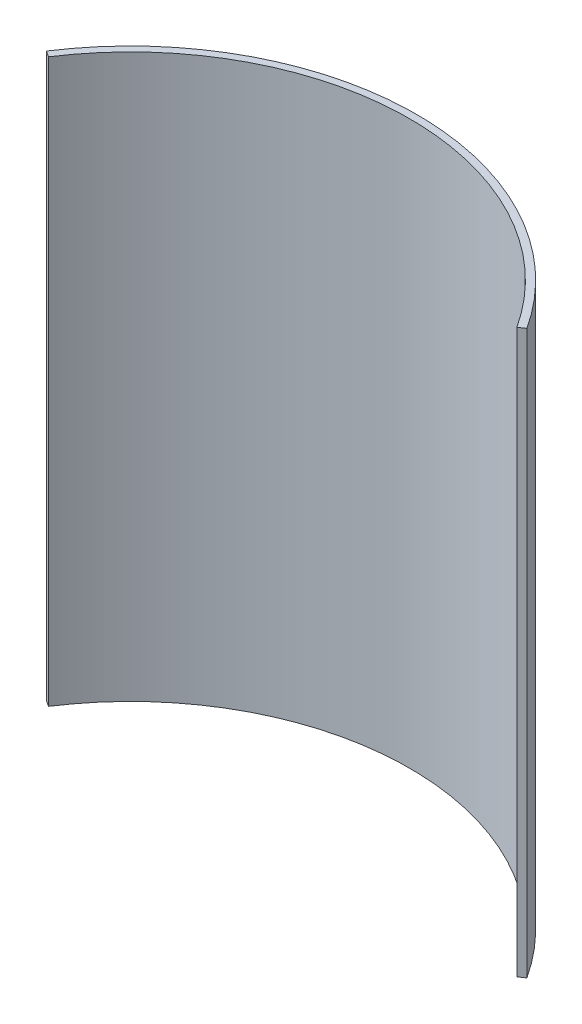
from build123d import *

# Parameters (mm, degrees)
BOSS_EXTRUDE1_DEPTH = 75.5


with BuildPart() as part:
    # Sketch1 → Boss-Extrude1 (new body)
    with BuildSketch(Plane(origin=(0, 0, 0), x_dir=(1, 0, 0), z_dir=(0, 1, 0))):
        with BuildLine():
            Line((-31.430031232, 20.454904955), (-32.243665164, 20.984424147))
            ThreePointArc((-32.243665164, 20.984424147), (0, 38.470768123), (32.243665164, 20.984424147))
            Line((32.243665164, 20.984424147), (31.430031232, 20.454904955))
            ThreePointArc((31.430031232, 20.454904955), (0, 37.5), (-31.430031232, 20.454904955))
        make_face()
    extrude(amount=-BOSS_EXTRUDE1_DEPTH)


solid = part.part
